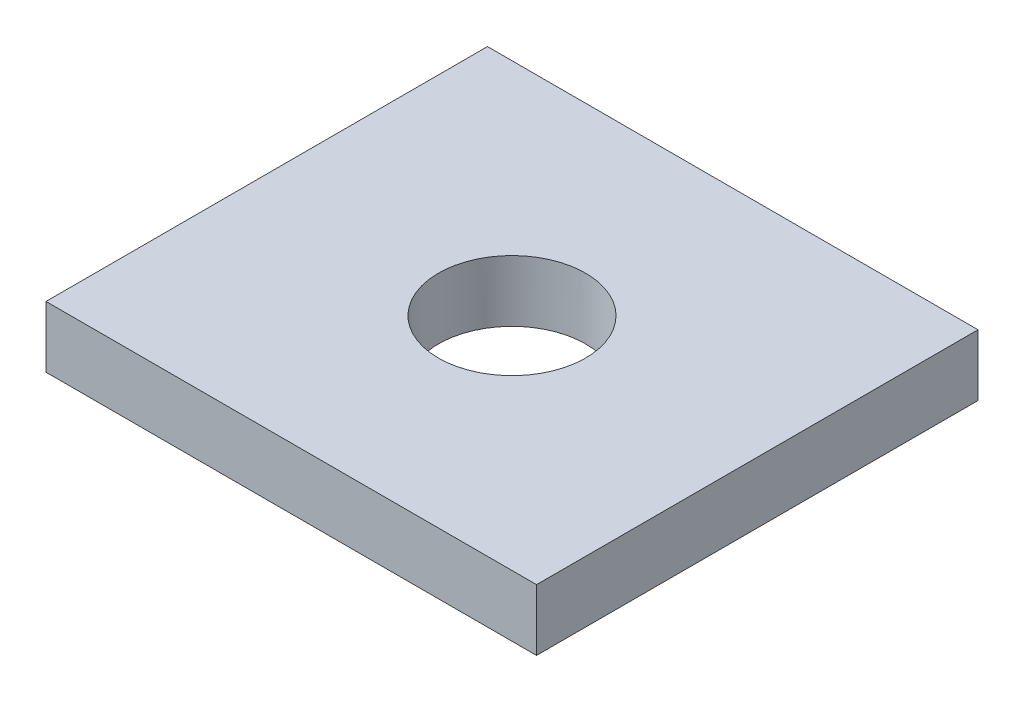
from build123d import *

# Parameters (mm, degrees)
SKETCH1_W          = 200
SKETCH1_H          = 180
BASE_DEPTH         = 25
SKETCH2_R          = 30
ACTUATOR_CUT_DEPTH = 40


with BuildPart() as part:
    # Sketch1 → base (new body)
    with BuildSketch(Plane(origin=(0, 0, 0), x_dir=(1, 0, 0), z_dir=(0, 1, 0))):
        Rectangle(SKETCH1_W, SKETCH1_H)
    extrude(amount=BASE_DEPTH)

    # Sketch2 → actuator cut (cut)
    with BuildSketch(Plane(origin=(0, 25, 0), x_dir=(1, 0, 0), z_dir=(0, 1, 0))):
        Circle(SKETCH2_R)
    extrude(amount=-ACTUATOR_CUT_DEPTH, mode=Mode.SUBTRACT)


solid = part.part
